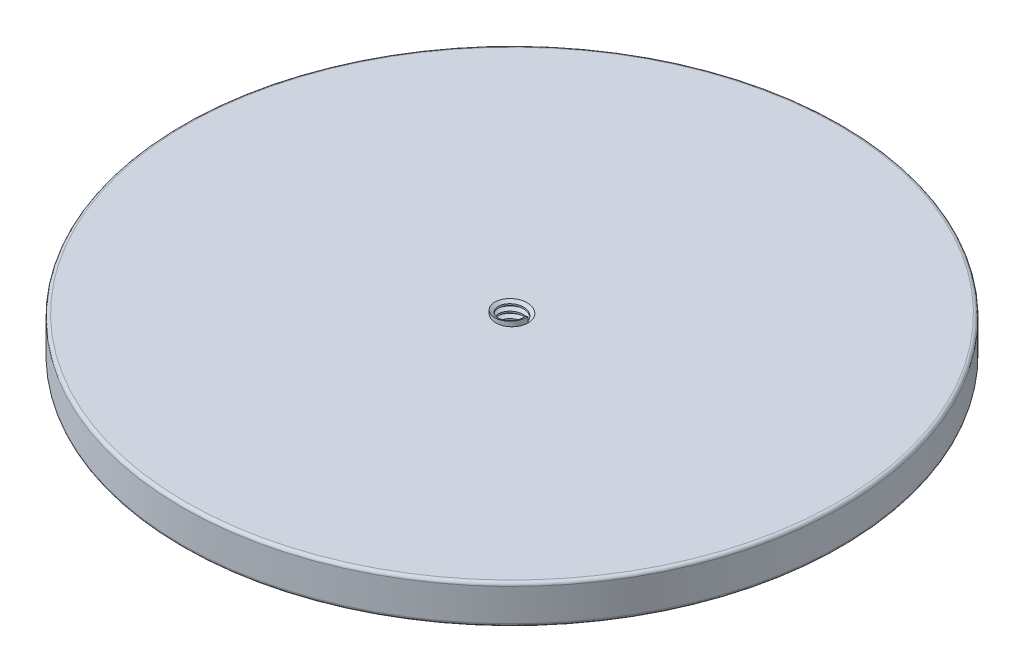
from build123d import *

# Parameters (mm, degrees)
SKETCH2_R           = 64.77
BOSS_EXTRUDE1_DEPTH = 7.62
FILLET1_R           = 0.635
BOSS_EXTRUDE2_START = -7.62
SKETCH3_R           = 28.448
BOSS_EXTRUDE2_DEPTH = 12.7
FILLET2_R           = 0.635
SKETCH4_R           = 3.175
CUT_EXTRUDE1_DEPTH  = 94.825413402
THREAD1_PITCH       = 1.27


with BuildPart() as part:
    # Sketch2 → Boss-Extrude1 (new body)
    with BuildSketch(Plane(origin=(0, 0, 0), x_dir=(1, 0, 0), z_dir=(0, 1, 0))):
        with Locations(Location((0, 0, 0), (0, 0, 270))):
            Circle(SKETCH2_R)
    extrude(amount=-BOSS_EXTRUDE1_DEPTH)

    # Fillet1
    fillet1_edges = [part.edges().sort_by_distance(p)[0] for p in [
        (0, 0, -64.77),
        (0, -7.62, -64.77),
    ]]
    fillet(fillet1_edges, radius=FILLET1_R)

    # Sketch3 → Boss-Extrude2 (add)
    with BuildSketch(Plane(origin=(0, 0, 0), x_dir=(1, 0, 0), z_dir=(0, 1, 0)).offset(BOSS_EXTRUDE2_START)):
        with Locations(Location((0, 0, 0), (0, 0, 270))):
            Circle(SKETCH3_R)
    extrude(amount=-BOSS_EXTRUDE2_DEPTH)

    # Fillet2
    fillet2_edges = [part.edges().sort_by_distance(p)[0] for p in [
        (0, -20.32, -28.448),
    ]]
    fillet(fillet2_edges, radius=FILLET2_R)

    # Sketch4 → Cut-Extrude1 (cut, through all)
    with BuildSketch(Plane.XZ.offset(20.32)):
        with Locations(Location((0, 0, 0), (0, 0, 270))):
            Circle(SKETCH4_R)
    extrude(amount=-CUT_EXTRUDE1_DEPTH, mode=Mode.SUBTRACT)

    # Thread1: the profile of Thread Profile1 profile screwed along a right-hand helix of 16 turns, 8 arcs to a turn; built about Z, then put on its axis
    thread1_z = Axis((0, 0, 0), (0, 0, 1))
    thread1_corners = [(3.1753, 0, -0.000173205), (3.1753, 0, 1.111423202), (2.487592339, 0, 0.714374998), (2.487592339, 0, 0.396874998)]
    with BuildLine(mode=Mode.PRIVATE) as thread1_profile:
        Line(thread1_corners[0], thread1_corners[1])
        Line(thread1_corners[1], thread1_corners[2])
        Line(thread1_corners[2], thread1_corners[3])
        Line(thread1_corners[3], thread1_corners[0])
    thread1_cap = Face(thread1_profile.wire())
    thread1_turn_angles = [0, 22.5, 45, 67.5, 90, 112.5, 135, 157.5, 180, 202.5, 225, 247.5, 270, 292.5, 315, 337.5, 360]
    thread1_turn_weights = [1, 0.9238795325112867, 1, 0.9238795325112867, 1, 0.9238795325112867, 1, 0.9238795325112867, 1, 0.9238795325112867, 1, 0.9238795325112867, 1, 0.9238795325112867, 1, 0.9238795325112867, 1]
    thread1_turn_rails = [Edge.make_bspline([Vector(p[0], p[1], 0).rotate(thread1_z, thread1_turn_angles[k]) / thread1_turn_weights[k] + Vector(0, 0, p[2] + THREAD1_PITCH * thread1_turn_angles[k] / 360) for k in range(17)], [0, 0, 0, 1, 1, 2, 2, 3, 3, 4, 4, 5, 5, 6, 6, 7, 7, 8, 8, 8], 2, thread1_turn_weights) for p in thread1_corners]
    thread1_turn_sides = [Face.make_surface_from_curves(thread1_turn_rails[p[0]], thread1_turn_rails[p[1]]) for p in [(0, 1), (1, 2), (2, 3), (3, 0)]]
    thread1 = Plane(origin=(0, -20.32, 0), x_dir=(1, 0, 0), z_dir=(0, 1, 0)) * Solid(Shell([*[p.moved(Location((0, 0, THREAD1_PITCH * i))) for i in range(16) for p in thread1_turn_sides], thread1_cap, thread1_cap.rotate(thread1_z, 5760).moved(Location((0, 0, THREAD1_PITCH * 5760 / 360)))]))
    add(thread1)


solid = part.part
